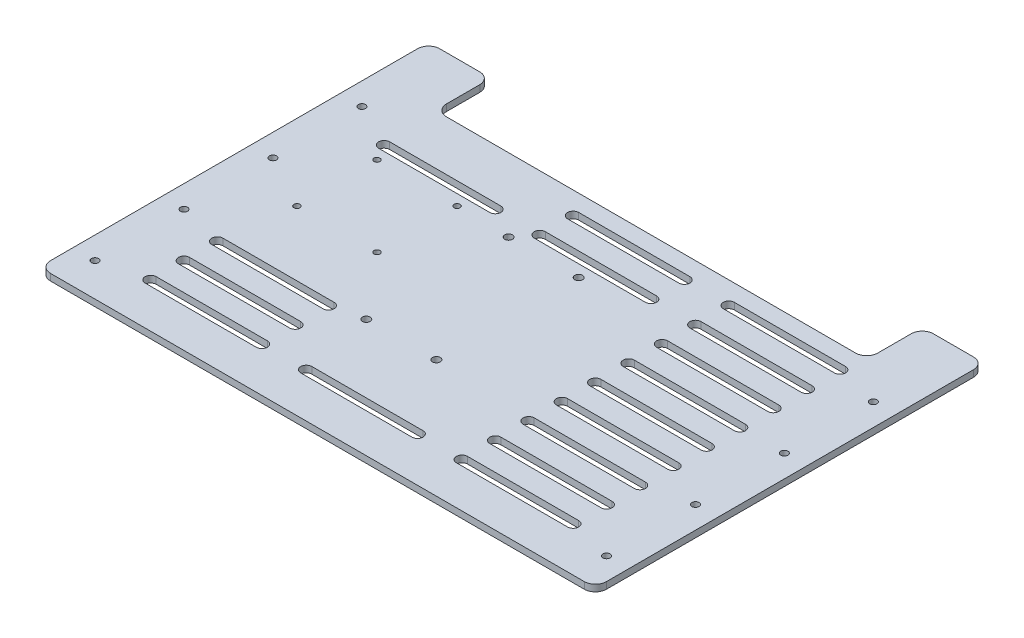
from build123d import *

# Parameters (mm, degrees)
EXTRUDE_1_DEPTH     = 3
FILLET_1_R          = 5
SKETCH_4_R          = 1.75
SKETCH_4_R_2        = 1.35
CUT_EXTRUDE_2_DEPTH = 10
CUT_EXTRUDE_3_DEPTH = 10
SKETCH_5_R          = 1.6
CUT_EXTRUDE_4_DEPTH = 10


with BuildPart() as part:
    # 草图1 → 凸台-拉伸1 (new body)
    with BuildSketch(Plane(origin=(0, 0, 0), x_dir=(1, 0, 0), z_dir=(0, 1, 0))):
        Polygon((-84.734156599, 82.359506041), (109.265843401, 82.359506041), (109.265843401, 107.359506041), (137.265843401, 107.359506041), (137.265843401, 82.359506041), (137.265843401, -67.640493959), (-112.734156599, -67.640493959), (-112.734156599, 55.552013884), (-112.734156599, 107.359506041), (-84.734156599, 107.359506041), align=None)
    extrude(amount=EXTRUDE_1_DEPTH)

    # 圆角1
    fillet_1_edges = [part.edges().sort_by_distance(p)[0] for p in [
        (137.265843401, 1.5, 67.640493959),
        (-112.734156599, 1.5, 67.640493959),
        (137.265843401, 1.5, -107.359506041),
        (109.265843401, 1.5, -107.359506041),
        (109.265843401, 1.5, -82.359506041),
        (-112.734156599, 1.5, -107.359506041),
        (-84.734156599, 1.5, -107.359506041),
        (-84.734156599, 1.5, -82.359506041),
    ]]
    fillet(fillet_1_edges, radius=FILLET_1_R)

    # 草图4 → 切除-拉伸2 (cut)
    with BuildSketch(Plane(origin=(0, 3, 0), x_dir=(1, 0, 0), z_dir=(0, 1, 0))):
        with Locations((-18.891317384, -14.5)):
            Circle(SKETCH_4_R)
        with Locations((12.608682616, -14.5)):
            Circle(SKETCH_4_R)
        with Locations((-42.582797937, 49.995)):
            Circle(SKETCH_4_R_2)
        with Locations((-18.891317384, 49.5)):
            Circle(SKETCH_4_R)
        with Locations((12.608682616, 49.5)):
            Circle(SKETCH_4_R)
        with Locations((-42.582797937, 13.995)):
            Circle(SKETCH_4_R_2)
        with Locations((-78.582797937, 13.995)):
            Circle(SKETCH_4_R_2)
        with Locations((-78.582797937, 49.995)):
            Circle(SKETCH_4_R_2)
    extrude(amount=-CUT_EXTRUDE_2_DEPTH, mode=Mode.SUBTRACT)

    # 草图4<3> → 切除-拉伸3 (cut)
    with BuildSketch(Plane(origin=(0, 3, 0), x_dir=(1, 0, 0), z_dir=(0, 1, 0))):
        with BuildLine():
            Line((57.265843401, 74.859506041), (107.265843401, 74.859506041))
            ThreePointArc((107.265843401, 74.859506041), (109.765843401, 72.359506041), (107.265843401, 69.859506041))
            Line((107.265843401, 69.859506041), (57.265843401, 69.859506041))
            ThreePointArc((57.265843401, 69.859506041), (54.765843401, 72.359506041), (57.265843401, 74.859506041))
        make_face()
        with BuildLine():
            Line((57.265843401, 59.859506041), (107.265843401, 59.859506041))
            ThreePointArc((107.265843401, 59.859506041), (109.765843401, 57.359506041), (107.265843401, 54.859506041))
            Line((107.265843401, 54.859506041), (57.265843401, 54.859506041))
            ThreePointArc((57.265843401, 54.859506041), (54.765843401, 57.359506041), (57.265843401, 59.859506041))
        make_face()
        with BuildLine():
            Line((57.265843401, 44.859506041), (107.265843401, 44.859506041))
            ThreePointArc((107.265843401, 44.859506041), (109.765843401, 42.359506041), (107.265843401, 39.859506041))
            Line((107.265843401, 39.859506041), (57.265843401, 39.859506041))
            ThreePointArc((57.265843401, 39.859506041), (54.765843401, 42.359506041), (57.265843401, 44.859506041))
        make_face()
        with BuildLine():
            Line((57.265843401, 29.859506041), (107.265843401, 29.859506041))
            ThreePointArc((107.265843401, 29.859506041), (109.765843401, 27.359506041), (107.265843401, 24.859506041))
            Line((107.265843401, 24.859506041), (57.265843401, 24.859506041))
            ThreePointArc((57.265843401, 24.859506041), (54.765843401, 27.359506041), (57.265843401, 29.859506041))
        make_face()
        with BuildLine():
            Line((57.265843401, 14.859506041), (107.265843401, 14.859506041))
            ThreePointArc((107.265843401, 14.859506041), (109.765843401, 12.359506041), (107.265843401, 9.859506041))
            Line((107.265843401, 9.859506041), (57.265843401, 9.859506041))
            ThreePointArc((57.265843401, 9.859506041), (54.765843401, 12.359506041), (57.265843401, 14.859506041))
        make_face()
        with BuildLine():
            Line((57.265843401, -0.140493959), (107.265843401, -0.140493959))
            ThreePointArc((107.265843401, -0.140493959), (109.765843401, -2.640493959), (107.265843401, -5.140493959))
            Line((107.265843401, -5.140493959), (57.265843401, -5.140493959))
            ThreePointArc((57.265843401, -5.140493959), (54.765843401, -2.640493959), (57.265843401, -0.140493959))
        make_face()
        with BuildLine():
            Line((57.265843401, -15.140493959), (107.265843401, -15.140493959))
            ThreePointArc((107.265843401, -15.140493959), (109.765843401, -17.640493959), (107.265843401, -20.140493959))
            Line((107.265843401, -20.140493959), (57.265843401, -20.140493959))
            ThreePointArc((57.265843401, -20.140493959), (54.765843401, -17.640493959), (57.265843401, -15.140493959))
        make_face()
        with BuildLine():
            Line((57.265843401, -30.140493959), (107.265843401, -30.140493959))
            ThreePointArc((107.265843401, -30.140493959), (109.765843401, -32.640493959), (107.265843401, -35.140493959))
            Line((107.265843401, -35.140493959), (57.265843401, -35.140493959))
            ThreePointArc((57.265843401, -35.140493959), (54.765843401, -32.640493959), (57.265843401, -30.140493959))
        make_face()
        with BuildLine():
            Line((57.265843401, -45.140493959), (107.265843401, -45.140493959))
            ThreePointArc((107.265843401, -45.140493959), (109.765843401, -47.640493959), (107.265843401, -50.140493959))
            Line((107.265843401, -50.140493959), (57.265843401, -50.140493959))
            ThreePointArc((57.265843401, -50.140493959), (54.765843401, -47.640493959), (57.265843401, -45.140493959))
        make_face()
        with BuildLine():
            Line((-12.734156599, 74.859506041), (37.265843401, 74.859506041))
            ThreePointArc((37.265843401, 74.859506041), (39.765843401, 72.359506041), (37.265843401, 69.859506041))
            Line((37.265843401, 69.859506041), (-12.734156599, 69.859506041))
            ThreePointArc((-12.734156599, 69.859506041), (-15.234156599, 72.359506041), (-12.734156599, 74.859506041))
        make_face()
        with BuildLine():
            Line((-12.734156599, 59.859506041), (37.265843401, 59.859506041))
            ThreePointArc((37.265843401, 59.859506041), (39.765843401, 57.359506041), (37.265843401, 54.859506041))
            Line((37.265843401, 54.859506041), (-12.734156599, 54.859506041))
            ThreePointArc((-12.734156599, 54.859506041), (-15.234156599, 57.359506041), (-12.734156599, 59.859506041))
        make_face()
        with BuildLine():
            Line((-82.734156599, 59.859506041), (-32.734156599, 59.859506041))
            ThreePointArc((-32.734156599, 59.859506041), (-30.234156599, 57.359506041), (-32.734156599, 54.859506041))
            Line((-32.734156599, 54.859506041), (-82.734156599, 54.859506041))
            ThreePointArc((-82.734156599, 54.859506041), (-85.234156599, 57.359506041), (-82.734156599, 59.859506041))
        make_face()
        with BuildLine():
            Line((-12.734156599, -45.140493959), (37.265843401, -45.140493959))
            ThreePointArc((37.265843401, -45.140493959), (39.765843401, -47.640493959), (37.265843401, -50.140493959))
            Line((37.265843401, -50.140493959), (-12.734156599, -50.140493959))
            ThreePointArc((-12.734156599, -50.140493959), (-15.234156599, -47.640493959), (-12.734156599, -45.140493959))
        make_face()
        with BuildLine():
            Line((-82.734156599, -45.140493959), (-32.734156599, -45.140493959))
            ThreePointArc((-32.734156599, -45.140493959), (-30.234156599, -47.640493959), (-32.734156599, -50.140493959))
            Line((-32.734156599, -50.140493959), (-82.734156599, -50.140493959))
            ThreePointArc((-82.734156599, -50.140493959), (-85.234156599, -47.640493959), (-82.734156599, -45.140493959))
        make_face()
        with BuildLine():
            Line((-82.734156599, -30.140493959), (-32.734156599, -30.140493959))
            ThreePointArc((-32.734156599, -30.140493959), (-30.234156599, -32.640493959), (-32.734156599, -35.140493959))
            Line((-32.734156599, -35.140493959), (-82.734156599, -35.140493959))
            ThreePointArc((-82.734156599, -35.140493959), (-85.234156599, -32.640493959), (-82.734156599, -30.140493959))
        make_face()
        with BuildLine():
            Line((-82.734156599, -15.140493959), (-32.734156599, -15.140493959))
            ThreePointArc((-32.734156599, -15.140493959), (-30.234156599, -17.640493959), (-32.734156599, -20.140493959))
            Line((-32.734156599, -20.140493959), (-82.734156599, -20.140493959))
            ThreePointArc((-82.734156599, -20.140493959), (-85.234156599, -17.640493959), (-82.734156599, -15.140493959))
        make_face()
    extrude(amount=-CUT_EXTRUDE_3_DEPTH, mode=Mode.SUBTRACT)

    # 草图5 → 切除-拉伸4 (cut)
    with BuildSketch(Plane(origin=(0, 3, 0), x_dir=(1, 0, 0), z_dir=(0, 1, 0))):
        with Locations((-102.734156599, 67.359506041)):
            Circle(SKETCH_5_R)
        with Locations((-102.734156599, 27.359506041)):
            Circle(SKETCH_5_R)
        with Locations((-102.734156599, -12.640493959)):
            Circle(SKETCH_5_R)
        with Locations((-102.734156599, -52.640493959)):
            Circle(SKETCH_5_R)
        with Locations((127.265843401, -52.640493959)):
            Circle(SKETCH_5_R)
        with Locations((127.265843401, -12.640493959)):
            Circle(SKETCH_5_R)
        with Locations((127.265843401, 27.359506041)):
            Circle(SKETCH_5_R)
        with Locations((127.265843401, 67.359506041)):
            Circle(SKETCH_5_R)
    extrude(amount=-CUT_EXTRUDE_4_DEPTH, mode=Mode.SUBTRACT)


solid = part.part
